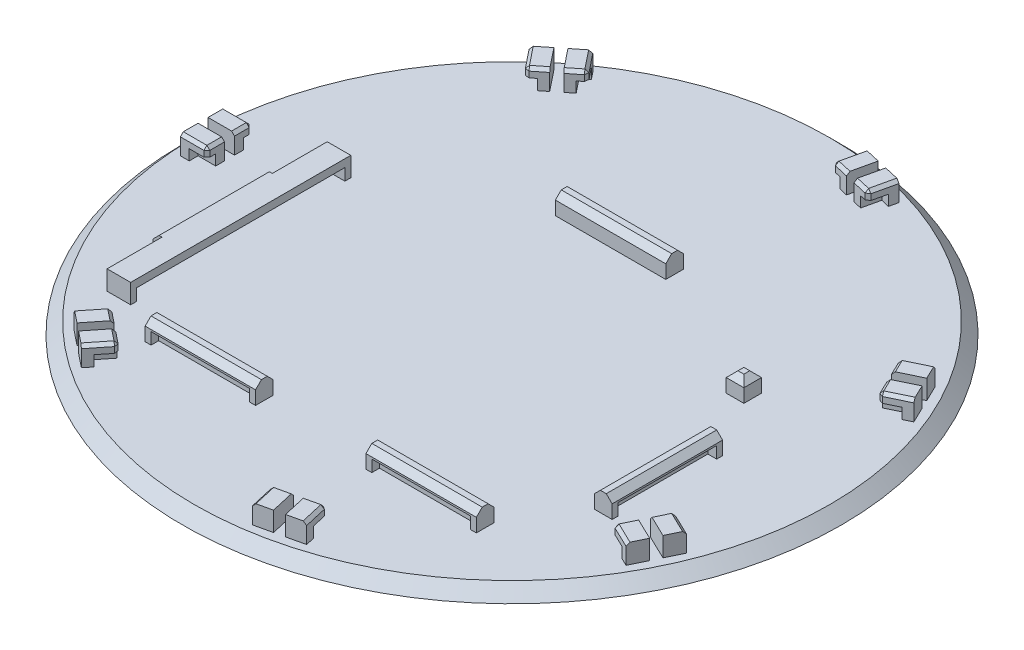
from build123d import *

# Parameters (mm, degrees)
LOCKING_SLIDES_W                               = 1.5
LOCKING_SLIDES_H                               = 0.15
BOSS_EXTRUDE_LOCKING_SLIDE_DEPTH               = 3.85
LOCKING_SLIDES_2_W                             = 3
LOCKING_SLIDES_2_H                             = 1.65
LOCKING_SLIDES_2_H_2                           = 0.15
BOSS_EXTRUDE_LOCKING_SLIDE_REINFORCE_DEPTH     = 2.35
LOCKING_SLIDES_3_W                             = 1.5
LOCKING_SLIDES_3_H                             = 0.15
LOCKING_SLIDES_3_W_2                           = 3
LOCKING_SLIDES_3_H_2                           = 1.65
CUT_EXTRUDE_LOCKING_SLIDE_GAP_DEPTH            = 0.85
CHAMFER_LOCKING_SLIDE_SIZE                     = 0.5
CIRPATTERN_LOCKING_SLIDES_COUNT                = 7
CHAMFER_LOCKING_SLIDE_OF_CIRPATTERN_LOCK_SIZE  = 0.5
EXTRUDE_THIN_START                             = 2
BATTERY_HOLDER_AREA_W                          = 18.76
BATTERY_HOLDER_AREA_H                          = 3
BATTERY_HOLDER_AREA_W_2                        = 3
BATTERY_HOLDER_AREA_H_2                        = 18.76
EXTRUDE_THIN_HOLDER_BARS_DEPTH                 = 3.3
CUT_EXTRUDE_THIN_START                         = 2
CUT_EXTRUDE_THIN_HOLDER_BARS_GROOVE_OUTL_W     = 16.76
CUT_EXTRUDE_THIN_HOLDER_BARS_GROOVE_OUTL_H     = 1.5
CUT_EXTRUDE_THIN_HOLDER_BARS_GROOVE_OUTL_W_2   = 1.5
CUT_EXTRUDE_THIN_HOLDER_BARS_GROOVE_OUTL_H_2   = 16.76
CUT_EXTRUDE_THIN_HOLDER_BARS_GROOVE_OUTL_H_3   = 1.3
CUT_EXTRUDE_THIN_HOLDER_BARS_GROOVE_DEPTH      = 2
BOSS_EXTRUDE_START                             = 2
BATTERY_HOLDER_AREA_6_W                        = 3
BATTERY_HOLDER_AREA_6_H                        = 3
BOSS_EXTRUDE_HOLDER_POST_DEPTH                 = 3.3
BATTERY_HOLDER_AREA_6_2_W                      = 4
BATTERY_HOLDER_AREA_6_2_H                      = 37.4
EXTRUDE_THIN_SLIDE_CLAMP_BASE_DEPTH            = 3.3
BATTERY_HOLDER_AREA_6_3_W                      = 2.3
BATTERY_HOLDER_AREA_6_3_H                      = 35.4
CUT_EXTRUDE_THIN_SLIDE_CLAMP_GROOVE_DEPTH      = 2
BATTERY_HOLDER_AREA_6_4_W                      = 3
BATTERY_HOLDER_AREA_6_4_H                      = 18.76
EXTRUDE_THIN_SLIDE_CLAMP_REVERSE_DEPTH         = 3.3
CUT_EXTRUDE_THIN_SLIDE_CLAMP_REVERSE_2_W       = 1.5
CUT_EXTRUDE_THIN_SLIDE_CLAMP_REVERSE_2_H       = 16.76
CUT_EXTRUDE_THIN_SLIDE_CLAMP_REVERSE_GRO_DEPTH = 2
CHAMFER_HOLDERS_SIZE                           = 1


# Read off the part's stored shape, not the designer's step: Cut-Extrude-Thin holder bars groove, Cut-Extrude-Thin slide clamp reverse groove
with BuildPart() as part:
    # Body outline → Revolve body (revolve)
    with BuildSketch(Plane.XY, mode=Mode.PRIVATE) as revolve_body_sk:
        Polygon((-54, 2), (0, 2), (0, 0), (-56, 0), align=None)
    revolve(revolve_body_sk.sketch.rotate(Axis((0, 0, 0), (0, 1, 0)), 180), axis=Axis((0, 0, 0), (0, 1, 0)))

    # Locking slides → Boss-Extrude locking slide (add, symmetric)
    with BuildSketch(Plane.XY):
        Polygon((-49.673205081, 5.3), (-52.5, 5.3), (-52.5, 5.25), (-49.759807621, 5.25), align=None)
        Polygon((-48.4, 5.3), (-49.673205081, 5.3), (-49.759807621, 5.25), (-52.5, 5.25), (-52.5, 2.15), (-51, 2.15), (-51, 3.8), (-48, 3.8), (-48, 4.9), align=None)
        Polygon((-48, 5.3), (-48.4, 5.3), (-48, 4.9), align=None)
        with Locations((-51.75, 2.075)):
            Rectangle(LOCKING_SLIDES_W, LOCKING_SLIDES_H)
    boss_extrude_locking_slide = extrude(amount=BOSS_EXTRUDE_LOCKING_SLIDE_DEPTH, both=True)

    # Locking slides<2> → Boss-Extrude locking slide reinforce (add, symmetric)
    with BuildSketch(Plane.XY):
        with Locations((-49.5, 2.975)):
            Rectangle(LOCKING_SLIDES_2_W, LOCKING_SLIDES_2_H)
        with Locations((-49.5, 2.075)):
            Rectangle(LOCKING_SLIDES_2_W, LOCKING_SLIDES_2_H_2)
    boss_extrude_locking_slide_reinforce = extrude(amount=BOSS_EXTRUDE_LOCKING_SLIDE_REINFORCE_DEPTH, both=True)

    # Locking slides<3> → Cut-Extrude locking slide gap (cut, symmetric)
    with BuildSketch(Plane.XY):
        Polygon((-48.4, 5.3), (-49.673205081, 5.3), (-49.759807621, 5.25), (-52.5, 5.25), (-52.5, 2.15), (-51, 2.15), (-51, 3.8), (-48, 3.8), (-48, 4.9), align=None)
        Polygon((-49.673205081, 5.3), (-52.5, 5.3), (-52.5, 5.25), (-49.759807621, 5.25), align=None)
        Polygon((-48, 5.3), (-48.4, 5.3), (-48, 4.9), align=None)
        with Locations((-51.75, 2.075)):
            Rectangle(LOCKING_SLIDES_3_W, LOCKING_SLIDES_3_H)
        with Locations((-49.5, 2.975)):
            Rectangle(LOCKING_SLIDES_3_W_2, LOCKING_SLIDES_3_H_2)
        with Locations((-49.5, 2.075)):
            Rectangle(LOCKING_SLIDES_3_W_2, LOCKING_SLIDES_3_H)
    cut_extrude_locking_slide_gap = extrude(amount=CUT_EXTRUDE_LOCKING_SLIDE_GAP_DEPTH, both=True, mode=Mode.SUBTRACT)

    # Chamfer locking slide
    chamfer_locking_slide_edges = [part.edges().sort_by_distance(p)[0] for p in [
        (-48, 4.55, 3.85),
        (-50.25, 5.3, 3.85),
        (-48, 5.3, 2.35),
        (-50.25, 5.3, -3.85),
        (-48, 4.55, -3.85),
        (-48, 5.3, -2.35),
    ]]
    chamfer(chamfer_locking_slide_edges, length=CHAMFER_LOCKING_SLIDE_SIZE)

    # CirPattern locking slides: Boss-Extrude locking slide, Boss-Extrude locking slide reinforce, Cut-Extrude locking slide gap ×7 about axis
    cirpattern_locking_slides_axis = Axis((0, 0, 0), (0, 1, 0))
    add([boss_extrude_locking_slide.rotate(cirpattern_locking_slides_axis, i * 360 / CIRPATTERN_LOCKING_SLIDES_COUNT) for i in range(1, CIRPATTERN_LOCKING_SLIDES_COUNT)])
    add([boss_extrude_locking_slide_reinforce.rotate(cirpattern_locking_slides_axis, i * 360 / CIRPATTERN_LOCKING_SLIDES_COUNT) for i in range(1, CIRPATTERN_LOCKING_SLIDES_COUNT)])
    add([cut_extrude_locking_slide_gap.rotate(cirpattern_locking_slides_axis, i * 360 / CIRPATTERN_LOCKING_SLIDES_COUNT) for i in range(1, CIRPATTERN_LOCKING_SLIDES_COUNT)], mode=Mode.SUBTRACT)

    # Chamfer locking slide of CirPattern lock
    chamfer_locking_slide_of_cirpattern_lock_edges = [part.edges().sort_by_distance(p)[0] for p in [
        (-26.917459282, 4.55, 39.928346896),
        (-28.320311336, 5.3, 41.687467731),
        (-28.090206505, 5.3, 38.993112193),
        (-34.340413751, 5.3, 36.886596257),
        (-32.937561697, 4.55, 35.127475421),
        (-31.764814473, 5.3, 36.062710124),
        (14.434477292, 4.55, 45.939834189),
        (14.935149393, 5.3, 48.133421991),
        (12.972085424, 5.3, 46.27361559),
        (7.428204469, 5.3, 49.846833183),
        (6.927532368, 4.55, 47.65324538),
        (8.389924236, 5.3, 47.31946398),
        (44.916958055, 4.55, 17.357689336),
        (46.944138008, 5.3, 18.333927749),
        (44.266132446, 5.3, 18.709142638),
        (43.603233216, 5.3, 25.271388032),
        (41.576053264, 4.55, 24.295149619),
        (42.226878872, 5.3, 22.943696317),
        (41.576053264, 4.55, -24.295149619),
        (43.603233216, 5.3, -25.271388032),
        (42.226878872, 5.3, -22.943696317),
        (46.944138008, 5.3, -18.333927749),
        (44.916958055, 4.55, -17.357689336),
        (44.266132446, 5.3, -18.709142638),
        (6.927532368, 4.55, -47.65324538),
        (7.428204469, 5.3, -49.846833183),
        (8.389924236, 5.3, -47.31946398),
        (14.935149393, 5.3, -48.133421991),
        (14.434477292, 4.55, -45.939834189),
        (12.972085424, 5.3, -46.27361559),
        (-32.937561697, 4.55, -35.127475421),
        (-34.340413751, 5.3, -36.886596257),
        (-31.764814473, 5.3, -36.062710124),
        (-28.320311336, 5.3, -41.687467731),
        (-26.917459282, 4.55, -39.928346896),
        (-28.090206505, 5.3, -38.993112193),
    ]]
    chamfer(chamfer_locking_slide_of_cirpattern_lock_edges, length=CHAMFER_LOCKING_SLIDE_OF_CIRPATTERN_LOCK_SIZE)

    # Battery holder area → Extrude-Thin holder bars (add)
    with BuildSketch(Plane(origin=(0, 0, 0), x_dir=(1, 0, 0), z_dir=(0, 1, 0)).offset(EXTRUDE_THIN_START)):
        with Locations((-18.76, -32.7)):
            Rectangle(BATTERY_HOLDER_AREA_W, BATTERY_HOLDER_AREA_H)
        with Locations((18.76, -32.7)):
            Rectangle(BATTERY_HOLDER_AREA_W, BATTERY_HOLDER_AREA_H)
        with Locations((36.2, -11.3)):
            Rectangle(BATTERY_HOLDER_AREA_W_2, BATTERY_HOLDER_AREA_H_2)
        with Locations((-2.45, 20.7)):
            Rectangle(BATTERY_HOLDER_AREA_W, BATTERY_HOLDER_AREA_H)
    extrude(amount=EXTRUDE_THIN_HOLDER_BARS_DEPTH)

    # Cut-Extrude-Thin holder bars groove outl → Cut-Extrude-Thin holder bars groove (cut)
    with BuildSketch(Plane(origin=(0, 0, 0), x_dir=(1, 0, 0), z_dir=(0, 1, 0)).offset(CUT_EXTRUDE_THIN_START)):
        with Locations((-2.45, 21.45)):
            Rectangle(CUT_EXTRUDE_THIN_HOLDER_BARS_GROOVE_OUTL_W, CUT_EXTRUDE_THIN_HOLDER_BARS_GROOVE_OUTL_H)
        with Locations((36.95, -11.3)):
            Rectangle(CUT_EXTRUDE_THIN_HOLDER_BARS_GROOVE_OUTL_W_2, CUT_EXTRUDE_THIN_HOLDER_BARS_GROOVE_OUTL_H_2)
        with Locations((18.76, -33.55)):
            Rectangle(CUT_EXTRUDE_THIN_HOLDER_BARS_GROOVE_OUTL_W, CUT_EXTRUDE_THIN_HOLDER_BARS_GROOVE_OUTL_H_3)
        with Locations((-18.76, -33.55)):
            Rectangle(CUT_EXTRUDE_THIN_HOLDER_BARS_GROOVE_OUTL_W, CUT_EXTRUDE_THIN_HOLDER_BARS_GROOVE_OUTL_H_3)
    extrude(amount=CUT_EXTRUDE_THIN_HOLDER_BARS_GROOVE_DEPTH, mode=Mode.SUBTRACT)

    # Battery holder area_6 → Boss-Extrude holder post (add)
    with BuildSketch(Plane(origin=(0, 0, 0), x_dir=(1, 0, 0), z_dir=(0, 1, 0)).offset(BOSS_EXTRUDE_START)):
        with Locations((30.3, 9.1)):
            Rectangle(BATTERY_HOLDER_AREA_6_W, BATTERY_HOLDER_AREA_6_H)
    extrude(amount=BOSS_EXTRUDE_HOLDER_POST_DEPTH)

    # Battery holder area_6 2 → Extrude-Thin slide clamp base (add)
    with BuildSketch(Plane(origin=(0, 0, 0), x_dir=(1, 0, 0), z_dir=(0, 1, 0)).offset(EXTRUDE_THIN_START)):
        with Locations((-36.8, -11.3)):
            Rectangle(BATTERY_HOLDER_AREA_6_2_W, BATTERY_HOLDER_AREA_6_2_H)
    extrude(amount=EXTRUDE_THIN_SLIDE_CLAMP_BASE_DEPTH)

    # Battery holder area_6 3 → Cut-Extrude-Thin slide clamp groove (cut)
    with BuildSketch(Plane(origin=(0, 0, 0), x_dir=(1, 0, 0), z_dir=(0, 1, 0)).offset(CUT_EXTRUDE_THIN_START)):
        with Locations((-35.65, -11.3)):
            Rectangle(BATTERY_HOLDER_AREA_6_3_W, BATTERY_HOLDER_AREA_6_3_H)
    extrude(amount=CUT_EXTRUDE_THIN_SLIDE_CLAMP_GROOVE_DEPTH, mode=Mode.SUBTRACT)

    # Battery holder area_6 4 → Extrude-Thin slide clamp reverse (add)
    with BuildSketch(Plane(origin=(0, 0, 0), x_dir=(1, 0, 0), z_dir=(0, 1, 0)).offset(EXTRUDE_THIN_START)):
        with Locations((-38.8, -11.3)):
            Rectangle(BATTERY_HOLDER_AREA_6_4_W, BATTERY_HOLDER_AREA_6_4_H)
    extrude(amount=EXTRUDE_THIN_SLIDE_CLAMP_REVERSE_DEPTH)

    # Cut-Extrude-Thin slide clamp reverse 2 → Cut-Extrude-Thin slide clamp reverse groove (cut)
    with BuildSketch(Plane(origin=(0, 0, 0), x_dir=(1, 0, 0), z_dir=(0, 1, 0)).offset(CUT_EXTRUDE_THIN_START)):
        with Locations((-39.55, -11.3)):
            Rectangle(CUT_EXTRUDE_THIN_SLIDE_CLAMP_REVERSE_2_W, CUT_EXTRUDE_THIN_SLIDE_CLAMP_REVERSE_2_H)
    extrude(amount=CUT_EXTRUDE_THIN_SLIDE_CLAMP_REVERSE_GRO_DEPTH, mode=Mode.SUBTRACT)

    # Chamfer holders
    chamfer_holders_edges = [part.edges().sort_by_distance(p)[0] for p in [
        (-18.76, 5.3, 34.2),
        (-18.76, 5.3, 31.2),
        (18.76, 5.3, 34.2),
        (18.76, 5.3, 31.2),
        (37.7, 5.3, 11.3),
        (34.7, 5.3, 11.3),
        (-2.45, 5.3, -22.2),
        (-2.45, 5.3, -19.2),
        (30.3, 5.3, -7.6),
        (31.8, 5.3, -9.1),
        (28.8, 5.3, -9.1),
        (30.3, 5.3, -10.6),
        (-40.3, 5.3, 11.3),
    ]]
    chamfer(chamfer_holders_edges, length=CHAMFER_HOLDERS_SIZE)


solid = part.part
